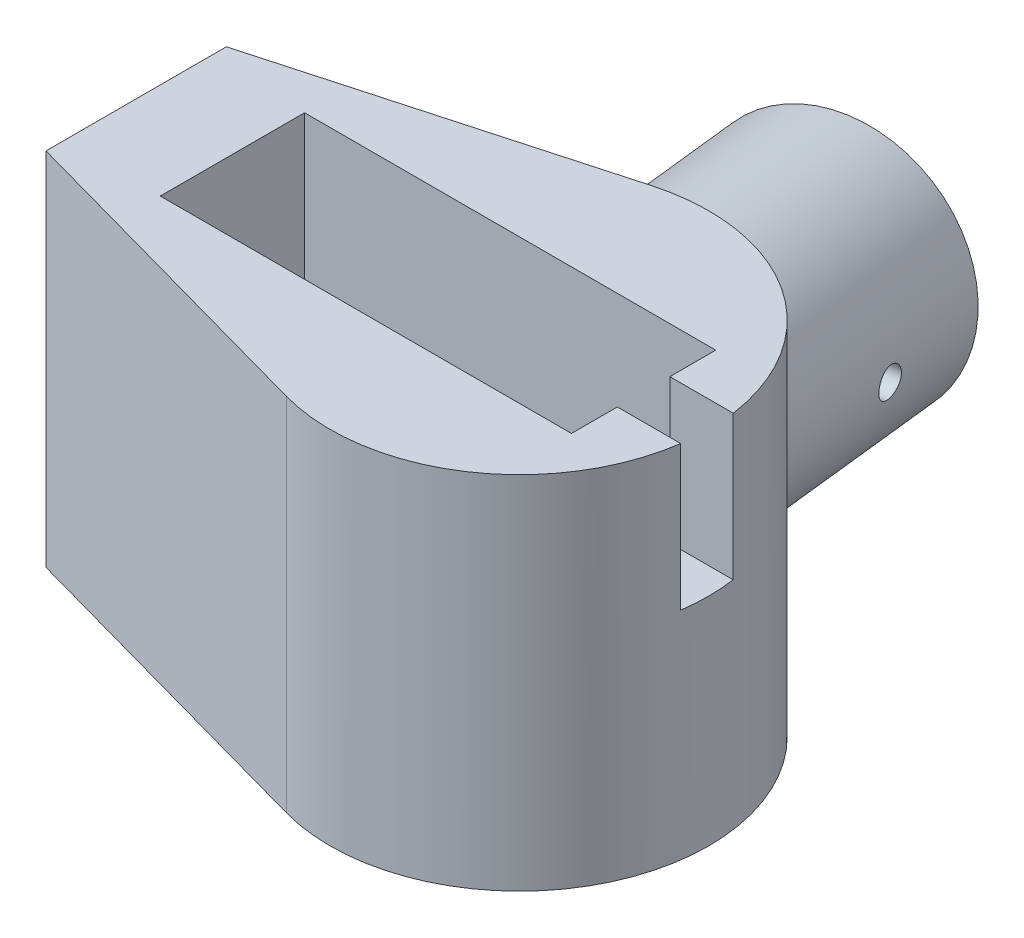
from build123d import *

# Parameters (mm, degrees)
BOSS_EXTRUDE1_DEPTH       = 40
REVOLVE1_START            = -44.95139953
REVOLVE1_OUTLINE_R        = 13.5
REVOLVE1_DEPTH            = 30.829897511
M18_CLEARANCE_HOLE1_D     = 20
M18_CLEARANCE_HOLE1_DEPTH = 25
SKETCH9_W                 = 1.6
SKETCH9_H                 = 27
CUT_EXTRUDE4_DEPTH        = 76.299241718
CUT_EXTRUDE4_DEPTH_BACK   = 76.299241718
SKETCH18_R                = 1.6
SCALE2_SCALE              = 1.25
SKETCH19_W                = 57
SKETCH19_H                = 20
CUT_EXTRUDE5_DEPTH        = 39
SKETCH20_W                = 40
SKETCH20_H                = 20
CUT_EXTRUDE6_DEPTH        = 10
SKETCH21_R                = 5.5
CUT_EXTRUDE7_DEPTH        = 96.0605556
SKETCH22_W                = 7.783449774
SKETCH22_H                = 2
SKETCH22_W_2              = 10.366550226
CUT_EXTRUDE8_DEPTH        = 2
SKETCH23_W                = 9.71853625
SKETCH23_H                = 7.281011564
CUT_EXTRUDE9_DEPTH        = 20
SKETCH25_W                = 2.5
SKETCH25_H                = 9
BOSS_EXTRUDE3_DEPTH       = 10
SKETCH26_W                = 2.5
SKETCH26_H                = 2
BOSS_EXTRUDE4_DEPTH       = 8
SKETCH27_R                = 2.1
CUT_EXTRUDE10_DEPTH       = 8
BOSS_EXTRUDE5_DEPTH       = 2
BOSS_EXTRUDE6_DEPTH       = 2


with BuildPart() as part:
    # Sketch1 → Boss-Extrude1 (new body)
    with BuildSketch(Plane(origin=(0, 40, 0), x_dir=(1, 0, 0), z_dir=(0, 1, 0))):
        with BuildLine():
            Line((-5.61521172, 20.235350191), (-42.5, 10))
            Line((-42.5, 10), (-42.5, -10))
            Line((-42.5, -10), (-5.61521172, -20.235350191))
            ThreePointArc((-5.61521172, -20.235350191), (21, 0), (-5.61521172, 20.235350191))
        make_face()
    extrude(amount=-BOSS_EXTRUDE1_DEPTH)

    # Revolve1: read off the stored shape, not the designer's step
    # Revolve1 outline → Revolve1 (add)
    with BuildSketch(Plane(origin=(0, 0, 0), x_dir=(0.9799247046208294, -0.02083962380947531, -0.19827577601224947), z_dir=(0.19936793441719802, 0.10243002349202102, 0.9745565745577031)).offset(REVOLVE1_START)):
        with Locations((-1.9070974, 22.005607966)):
            Circle(REVOLVE1_OUTLINE_R)
    extrude(amount=REVOLVE1_DEPTH)

    # M18 Clearance Hole1
    with Locations(Plane(origin=(-8.961867673, -4.60437291, -43.807681948), x_dir=(-0.9799247046208296, 0.02083962380947534, 0.19827577601224922), z_dir=(-0.19936793441719777, -0.10243002349202121, -0.9745565745577032))):
        with Locations((1.9070974, 22.005607966)):
            Hole(M18_CLEARANCE_HOLE1_D / 2, depth=M18_CLEARANCE_HOLE1_DEPTH)

    # Sketch9 → M3.5 Clearance Hole1 (revolve, cut)
    with BuildSketch(Plane(origin=(-18.009225855, 18.806465846, -31.591069121), x_dir=(-0.12392681772022805, 0.7153744254872676, -0.6876638533531477), z_dir=(0.1561720753640579, 0.6984304843277114, 0.6984304843277114))):
        with Locations((0.8, 13.5)):
            Rectangle(SKETCH9_W, SKETCH9_H)
    revolve(axis=Axis((-11.78670398, 18.674134235, -32.850120299), (-0.9799247046208297, 0.020839623809475325, 0.19827577601224802)), mode=Mode.SUBTRACT)

    # Sketch18 → Cut-Extrude4 (cut, two sides: drawn at the far end of the back side and taken through both)
    with BuildSketch(Plane(origin=(-1.740210315, 0.03700828, 0.352110268), x_dir=(-0.19823095447813932, 0.004215689735382395, -0.9801462730872066), z_dir=(0.9799247046208297, -0.020839623809475356, -0.19827577601224802)).offset(-CUT_EXTRUDE4_DEPTH_BACK)):
        with Locations(Location((34.613136918, 18.419306886, 0), (0, 0, 359.758405588))):
            Circle(SKETCH18_R)
    extrude(amount=CUT_EXTRUDE4_DEPTH + CUT_EXTRUDE4_DEPTH_BACK, mode=Mode.SUBTRACT)


with BuildPart() as part_1:
    # Scale2: scaled about (0, 0, 0)
    add(part.part.scale(SCALE2_SCALE))

    # Sketch19 → Cut-Extrude5 (cut)
    with BuildSketch(Plane(origin=(0, 50, 0), x_dir=(1, 0, 0), z_dir=(0, 1, 0))):
        with Locations((-11.2875, 0)):
            Rectangle(SKETCH19_W, SKETCH19_H)
    extrude(amount=-CUT_EXTRUDE5_DEPTH, mode=Mode.SUBTRACT)

    # Sketch20 → Cut-Extrude6 (cut)
    with BuildSketch(Plane(origin=(0, 11, 0), x_dir=(1, 0, 0), z_dir=(0, 1, 0))):
        with Locations((-13.154050226, 0)):
            Rectangle(SKETCH20_W, SKETCH20_H)
    extrude(amount=-CUT_EXTRUDE6_DEPTH, mode=Mode.SUBTRACT)

    # Sketch21 → Cut-Extrude7 (cut, through all)
    with BuildSketch(Plane.XZ):
        with Locations(Location((0, 0, 0), (0, 0, 270))):
            Circle(SKETCH21_R)
    extrude(amount=-CUT_EXTRUDE7_DEPTH, mode=Mode.SUBTRACT)

    # Sketch22 → Cut-Extrude8 (cut)
    with BuildSketch(Plane(origin=(0, 11, 0), x_dir=(1, 0, 0), z_dir=(0, 1, 0))):
        with Locations((-37.045775113, 0)):
            Rectangle(SKETCH22_W, SKETCH22_H)
        with Locations((12.029224887, 0)):
            Rectangle(SKETCH22_W_2, SKETCH22_H)
    extrude(amount=-CUT_EXTRUDE8_DEPTH, mode=Mode.SUBTRACT)

    # Sketch23 → Cut-Extrude9 (cut)
    with BuildSketch(Plane(origin=(0, 50, 0), x_dir=(1, 0, 0), z_dir=(0, 1, 0))):
        with Locations((22.071768125, 0)):
            Rectangle(SKETCH23_W, SKETCH23_H)
    extrude(amount=-CUT_EXTRUDE9_DEPTH, mode=Mode.SUBTRACT)

    # Sketch25 → Boss-Extrude3 (add)
    with BuildSketch(Plane(origin=(0, 1, 0), x_dir=(1, 0, 0), z_dir=(0, 1, 0))):
        with Locations((-31.904050226, 5.5)):
            Rectangle(SKETCH25_W, SKETCH25_H)
        with Locations((-31.904050226, -5.5)):
            Rectangle(SKETCH25_W, SKETCH25_H)
    extrude(amount=BOSS_EXTRUDE3_DEPTH)

    # Sketch26 → Boss-Extrude4 (add)
    with BuildSketch(Plane(origin=(0, 1, 0), x_dir=(1, 0, 0), z_dir=(0, 1, 0))):
        with Locations((-31.904050226, 0)):
            Rectangle(SKETCH26_W, SKETCH26_H)
    extrude(amount=BOSS_EXTRUDE4_DEPTH)

    # Sketch27 → Cut-Extrude10 (cut)
    with BuildSketch(Plane(origin=(0, 11, 0), x_dir=(1, 0, 0), z_dir=(0, 1, 0))):
        with Locations(Location((14.75, 4.85, 0), (0, 0, 270))):
            Circle(SKETCH27_R)
        with Locations(Location((14.75, -4.85, 0), (0, 0, 270))):
            Circle(SKETCH27_R)
        with Locations(Location((-34.75, 4.85, 0), (0, 0, 270))):
            Circle(SKETCH27_R)
        with Locations(Location((-34.75, -4.85, 0), (0, 0, 270))):
            Circle(SKETCH27_R)
    extrude(amount=-CUT_EXTRUDE10_DEPTH, mode=Mode.SUBTRACT)

    # Sketch35 → Boss-Extrude5 (add)
    with BuildSketch(Plane.XZ):
        with BuildLine():
            Line((-2.5, 7.071067812), (-2.5, 5.454356057))
            ThreePointArc((-2.5, 5.454356057), (0, 6), (2.5, 5.454356057))
            Line((2.5, 5.454356057), (2.5, 7.071067812))
            ThreePointArc((2.5, 7.071067812), (0, 7.5), (-2.5, 7.071067812))
        make_face()
    extrude(amount=BOSS_EXTRUDE5_DEPTH)

    # Sketch36 → Boss-Extrude6 (add)
    with BuildSketch(Plane.XZ.offset(2)):
        with BuildLine():
            Line((-2.5, 5.454356057), (-2.5, 11.42978565))
            ThreePointArc((-2.5, 11.42978565), (0, 11.7), (2.5, 11.42978565))
            Line((2.5, 11.42978565), (2.5, 5.454356057))
            ThreePointArc((2.5, 5.454356057), (0, 6), (-2.5, 5.454356057))
        make_face()
    extrude(amount=BOSS_EXTRUDE6_DEPTH)


solid = part_1.part
